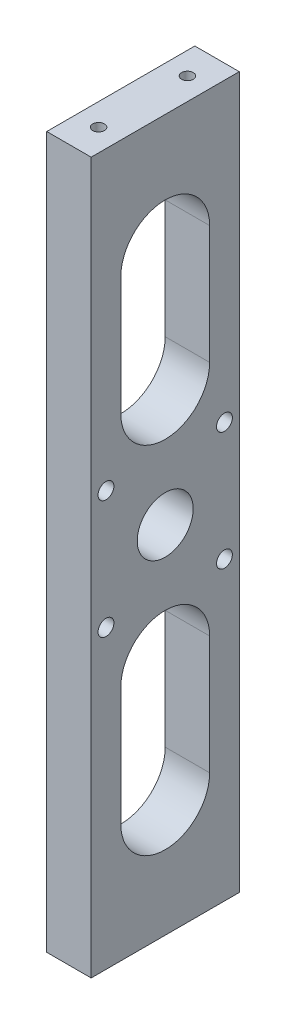
from build123d import *

# Parameters (mm, degrees)
SKETCH1_W                      = 31.75
SKETCH1_H                      = 152.4
BOSS_EXTRUDE1_DEPTH            = 4.7625
M3X0_5_TAPPED_HOLE1_AT_2_COUNT = 2
M3X0_5_TAPPED_HOLE1_AT_2_PITCH = 19.05
F_12_0MM_DOWEL_HOLE1_D         = 12
CUT_EXTRUDE1_DEPTH             = 79.416715374
M3_CLEARANCE_HOLE1_D           = 3.4
M3_CLEARANCE_HOLE1_DEPTH       = 15.24
M3_CLEARANCE_HOLE1_TIP         = 1.021463052


with BuildPart() as part:
    # Sketch1 → Boss-Extrude1 (new, symmetric)
    with BuildSketch(Plane(origin=(0, 0, 0), x_dir=(0, 0, -1), z_dir=(1, 0, 0))):
        Rectangle(SKETCH1_W, SKETCH1_H)
    extrude(amount=BOSS_EXTRUDE1_DEPTH, both=True)

    # Sketch4 → M3x0.5 Tapped Hole1 (revolve, cut)
    with BuildSketch(Plane(origin=(0, 76.2, -9.525), x_dir=(0, 0, 1), z_dir=(1, 0, 0))):
        Polygon((0, 0), (0, 13.451075774), (1.25, 12.7), (1.25, 0), align=None)
    m3x0_5_tapped_hole1 = revolve(axis=Axis((0, 82.55, -9.525), (0, -1, 0)), mode=Mode.SUBTRACT)

    # M3x0.5 Tapped Hole1 at 2: M3x0.5 Tapped Hole1 ×2
    with Locations(*[(0, 0, i * M3X0_5_TAPPED_HOLE1_AT_2_PITCH) for i in range(1, M3X0_5_TAPPED_HOLE1_AT_2_COUNT)]):
        add(m3x0_5_tapped_hole1, mode=Mode.SUBTRACT)

    # Mirror1: M3x0.5 Tapped Hole1 across plane
    add(m3x0_5_tapped_hole1.mirror(Plane.ZX), mode=Mode.SUBTRACT)

    # Mirror1 copy 1 sketch → Mirror1 copy 1 (revolve, cut)
    with BuildSketch(Plane(origin=(0, -76.2, 9.525), x_dir=(0, 0, 1), z_dir=(1, 0, 0))):
        Polygon((0, 0), (0, -13.451075774), (1.25, -12.7), (1.25, 0), align=None)
    revolve(axis=Axis((0, -82.55, 9.525), (0, -1, 0)), mode=Mode.SUBTRACT)

    # Ø12.0mm Dowel Hole1 (through all)
    with Locations(Plane(origin=(4.7625, 0, 0), x_dir=(0, 0, -1), z_dir=(1, 0, 0))):
        with Locations((0, 0)):
            Hole(F_12_0MM_DOWEL_HOLE1_D / 2)

    # Sketch9 → Cut-Extrude1 (cut, through all)
    with BuildSketch(Plane(origin=(4.7625, 0, 0), x_dir=(0, 0, -1), z_dir=(1, 0, 0))):
        with BuildLine():
            ThreePointArc((9.525, -25.4), (6.735192091, -18.664807909), (0, -15.875))
            ThreePointArc((0, -15.875), (-6.735192091, -18.664807909), (-9.525, -25.4))
            Line((-9.525, -25.4), (-9.525, -50.8))
            ThreePointArc((-9.525, -50.8), (0, -60.325), (9.525, -50.8))
            Line((9.525, -50.8), (9.525, -25.4))
        make_face()
        with BuildLine():
            Line((9.525, 25.4), (9.525, 50.8))
            ThreePointArc((9.525, 50.8), (0, 60.325), (-9.525, 50.8))
            Line((-9.525, 50.8), (-9.525, 25.4))
            ThreePointArc((-9.525, 25.4), (-6.735192091, 18.664807909), (0, 15.875))
            ThreePointArc((0, 15.875), (6.735192091, 18.664807909), (9.525, 25.4))
        make_face()
    extrude(amount=-CUT_EXTRUDE1_DEPTH, mode=Mode.SUBTRACT)

    # M3 Clearance Hole1
    with Locations(Plane.ZY.offset(4.7625)):
        with Locations((-12.7, 12.7), (12.7, 12.7), (12.7, -12.7), (-12.7, -12.7)):
            Hole(M3_CLEARANCE_HOLE1_D / 2, depth=M3_CLEARANCE_HOLE1_DEPTH)
            with Locations((0, 0, -(M3_CLEARANCE_HOLE1_DEPTH + M3_CLEARANCE_HOLE1_TIP / 2))):  # 118° drill point
                Cone(0, M3_CLEARANCE_HOLE1_D / 2, M3_CLEARANCE_HOLE1_TIP, mode=Mode.SUBTRACT)


solid = part.part
